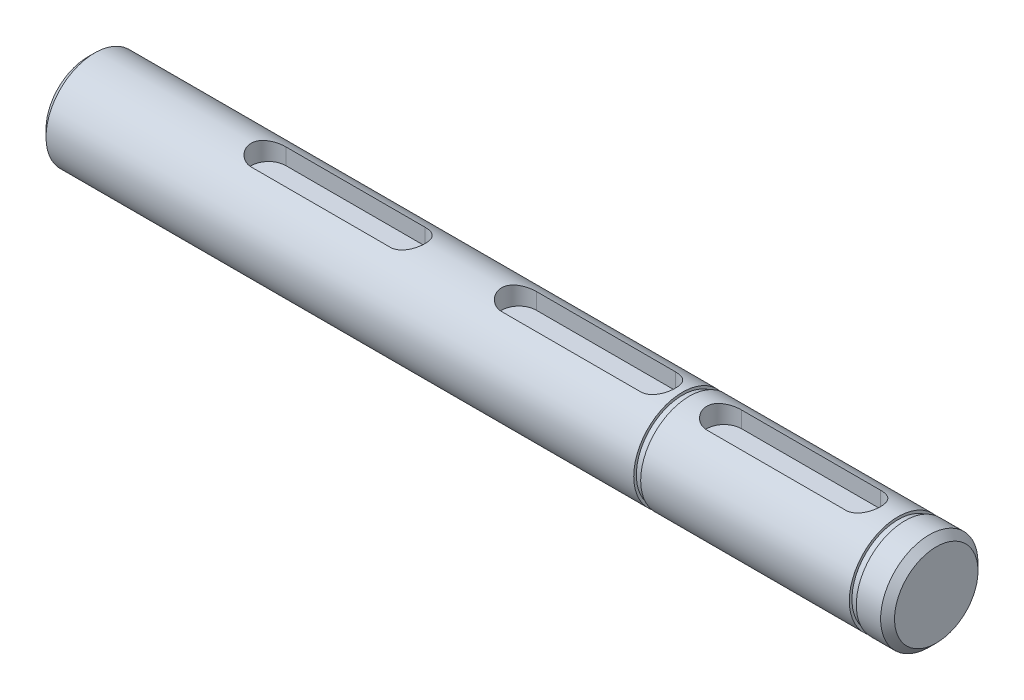
from build123d import *
from build123d.topology import SkipClean

# Parameters (mm, degrees)
SKETCH1_R           = 7
BOSS_EXTRUDE1_DEPTH = 34
CUT_EXTRUDE1_DEPTH  = 2.8
SKETCH5_R           = 7
BOSS_EXTRUDE3_DEPTH = 20
BOSS_EXTRUDE4_START = 34
SKETCH7_R           = 7
BOSS_EXTRUDE4_DEPTH = 34
SKETCH11_W          = 1
SKETCH11_H          = 0.75
CHAMFER1_SIZE       = 1
CUT_EXTRUDE3_DEPTH  = 2.8


with BuildPart() as part:
    # Sketch1 → Boss-Extrude1 (new, symmetric)
    with BuildSketch(Plane(origin=(0, 0, 0), x_dir=(0, 0, -1), z_dir=(1, 0, 0))):
        Circle(SKETCH1_R)
    extrude(amount=BOSS_EXTRUDE1_DEPTH, both=True)

    # Sketch4 → Cut-Extrude1 (cut)
    with BuildSketch(Plane(origin=(0, 7, 0), x_dir=(1, 0, 0), z_dir=(0, 1, 0))):
        with BuildLine():
            Line((-28, 2.5), (-8, 2.5))
            ThreePointArc((-8, 2.5), (-5.5, 0), (-8, -2.5))
            Line((-8, -2.5), (-28, -2.5))
            ThreePointArc((-28, -2.5), (-30.5, 0), (-28, 2.5))
        make_face()
    cut_extrude1 = extrude(amount=-CUT_EXTRUDE1_DEPTH, mode=Mode.SUBTRACT)

    # Mirror1: Cut-Extrude1 across plane
    add(cut_extrude1.mirror(Plane(origin=(0, 0, 0), x_dir=(0, 0, 1), z_dir=(1, 0, 0))), mode=Mode.SUBTRACT)

    # Sketch5 → Boss-Extrude3 (add)
    with BuildSketch(Plane.ZY.offset(34)):
        Circle(SKETCH5_R)
    extrude(amount=BOSS_EXTRUDE3_DEPTH)

    # Sketch7 → Boss-Extrude4 (add)
    with SkipClean():  # the faces are left unmerged after this step: merging them gives an invalid solid
        with BuildSketch(Plane(origin=(34, 0, 0), x_dir=(0, 0, -1), z_dir=(1, 0, 0)).offset(BOSS_EXTRUDE4_START)):
            Circle(SKETCH7_R)
        extrude(amount=-BOSS_EXTRUDE4_DEPTH)

    # Sketch11 → Cut-Revolve1 (revolve, cut)
    with BuildSketch(Plane.XY):
        with Locations((63, 7)):
            Rectangle(SKETCH11_W, SKETCH11_H)
        with Locations((32, 7)):
            Rectangle(SKETCH11_W, SKETCH11_H)
    revolve(axis=Axis((71.5, 0, 0), (-1, 0, 0)), mode=Mode.SUBTRACT)

    # Chamfer1
    chamfer1_edges = [part.edges().sort_by_distance(p)[0] for p in [
        (-54, 0, -7),
        (68, 0, 7),
    ]]
    chamfer(chamfer1_edges, length=CHAMFER1_SIZE)

    # Sketch9 → Cut-Extrude3 (cut)
    with BuildSketch(Plane(origin=(0, 7, 0), x_dir=(1, 0, 0), z_dir=(0, 1, 0))):
        with BuildLine():
            Line((37.5, 2.5), (57.5, 2.5))
            ThreePointArc((57.5, 2.5), (60, 0), (57.5, -2.5))
            Line((57.5, -2.5), (37.5, -2.5))
            ThreePointArc((37.5, -2.5), (35, 0), (37.5, 2.5))
        make_face()
    extrude(amount=-CUT_EXTRUDE3_DEPTH, mode=Mode.SUBTRACT)


solid = part.part
